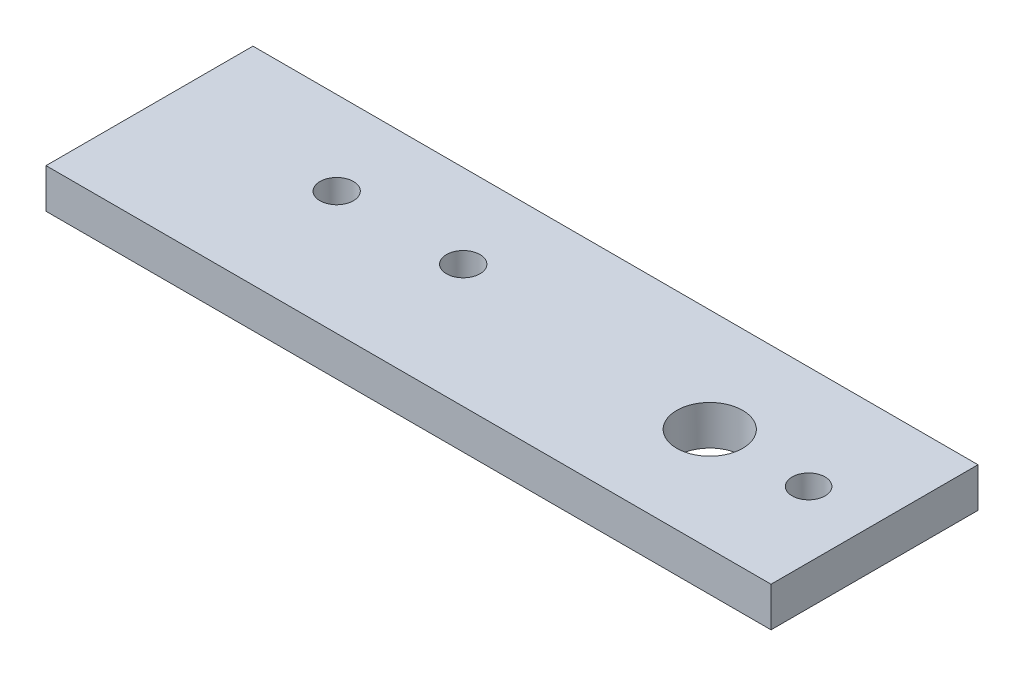
from build123d import *

# Parameters (mm, degrees)
SKETCH1_W               = 110
SKETCH1_H               = 31.4
BOSS_EXTRUDE1_DEPTH     = 6
CUT_EXTRUDE1_DEPTH      = 58.510781598
CUT_EXTRUDE1_DEPTH_BACK = 58.510781598
SKETCH2_R               = 2.54
SKETCH2_R_2             = 5
SKETCH2_R_3             = 2.5


with BuildPart() as part:
    # Sketch1 → Boss-Extrude1 (new body)
    with BuildSketch(Plane(origin=(0, 0, 0), x_dir=(1, 0, 0), z_dir=(0, 1, 0))):
        Rectangle(SKETCH1_W, SKETCH1_H)
    extrude(amount=BOSS_EXTRUDE1_DEPTH)

    # Sketch2 → Cut-Extrude1 (cut, two sides: drawn at the far end of the back side and taken through both)
    with BuildSketch(Plane(origin=(0, 6, 0), x_dir=(1, 0, 0), z_dir=(0, 1, 0)).offset(-CUT_EXTRUDE1_DEPTH_BACK)):
        with Locations((-10.4, 3)):
            Circle(SKETCH2_R)
        with Locations((-29.6, 3)):
            Circle(SKETCH2_R)
        with Locations((30, 0)):
            Circle(SKETCH2_R_2)
        with Locations((45, 0)):
            Circle(SKETCH2_R_3)
    extrude(amount=CUT_EXTRUDE1_DEPTH + CUT_EXTRUDE1_DEPTH_BACK, mode=Mode.SUBTRACT)


solid = part.part
